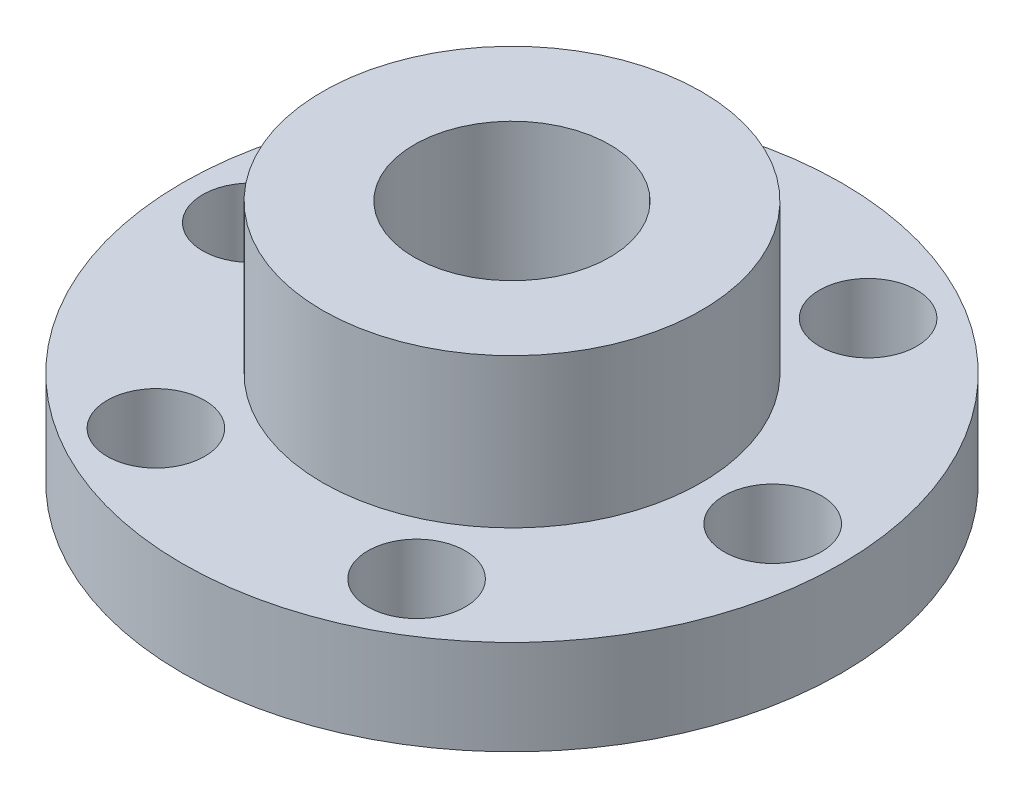
from build123d import *

# Parameters (mm, degrees)
SKETCH1_R          = 22.098
SKETCH1_R_2        = 4.826
MAIN_BODY_DEPTH    = 6.35
SKETCH2_R          = 12.7
SKETCH2_R_2        = 6.5484375
TAP_BOSS_DEPTH     = 10.000000066
SKETCH6_R          = 3.2639
CUT_EXTRUDE1_DEPTH = 33.81224176
CIRPATTERN1_COUNT  = 6


with BuildPart() as part:
    # Sketch1 → main body (new body)
    with BuildSketch(Plane(origin=(0, 0, 0), x_dir=(1, 0, 0), z_dir=(0, 1, 0))):
        Circle(SKETCH1_R)
        Circle(SKETCH1_R_2, mode=Mode.SUBTRACT)
    extrude(amount=MAIN_BODY_DEPTH)

    # Sketch2 → tap boss (add)
    with BuildSketch(Plane(origin=(0, 6.35, 0), x_dir=(1, 0, 0), z_dir=(0, 1, 0))):
        Circle(SKETCH2_R)
        Circle(SKETCH2_R_2, mode=Mode.SUBTRACT)
    extrude(amount=TAP_BOSS_DEPTH)

    # Sketch6 → Cut-Extrude1 (cut, through all)
    with BuildSketch(Plane(origin=(0, 6.35, 0), x_dir=(1, 0, 0), z_dir=(0, 1, 0))):
        with Locations((-17.472412237, 0)):
            Circle(SKETCH6_R)
    cut_extrude1 = extrude(amount=-CUT_EXTRUDE1_DEPTH, mode=Mode.SUBTRACT)

    # CirPattern1: Cut-Extrude1 ×6 about axis
    cirpattern1_axis = Axis((0, 6.35, 0), (0, 1, 0))
    for i in range(1, CIRPATTERN1_COUNT):
        add(cut_extrude1.rotate(cirpattern1_axis, i * 360 / CIRPATTERN1_COUNT), mode=Mode.SUBTRACT)


solid = part.part
